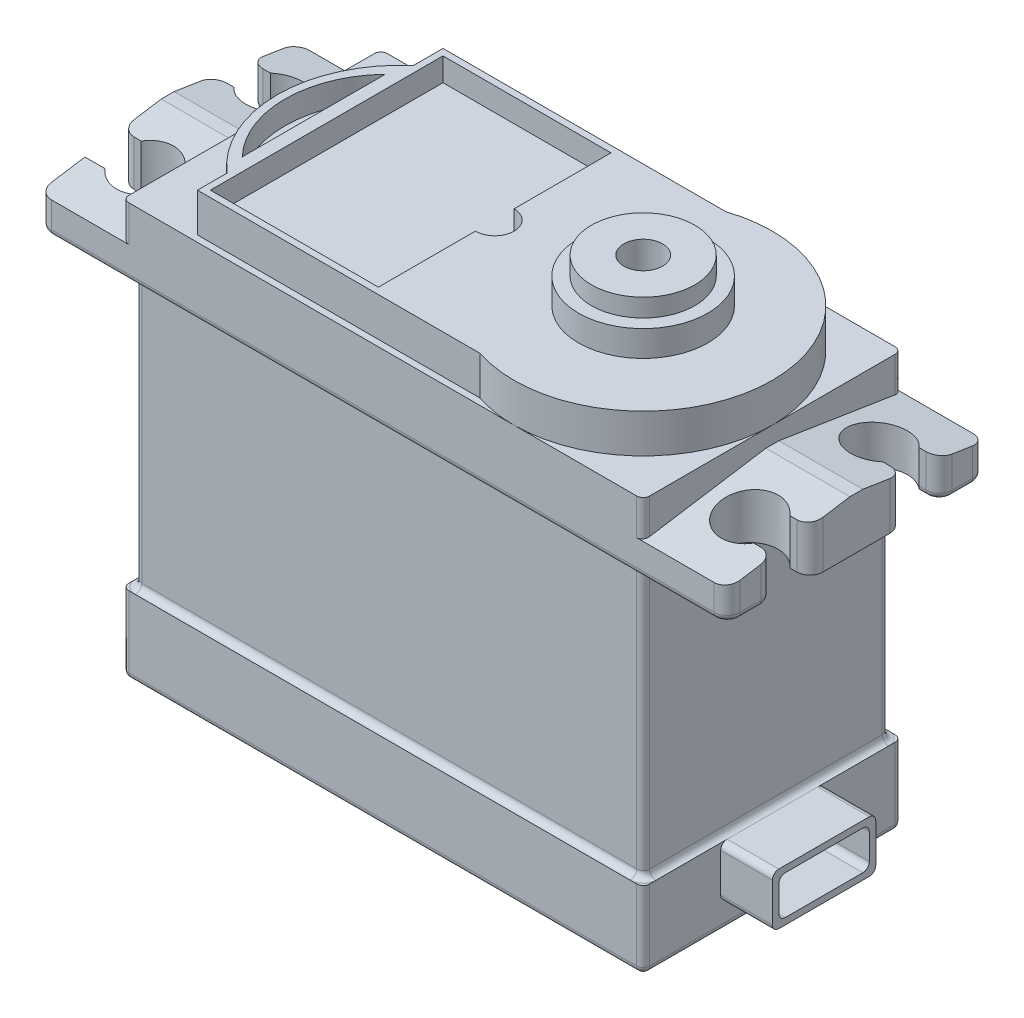
from build123d import *

# Parameters (mm, degrees)
SKETCH_2_W               = 40.3
SKETCH_2_H               = 32
EXTRUDE_1_DEPTH          = 20
SKETCH_3_W               = 20
SKETCH_3_H               = 4
EXTRUDE_2_DEPTH          = 6.5
CUT_EXTRUDE_4_DEPTH      = 6.5
SKETCH_4_W               = 20
SKETCH_4_H               = 4
EXTRUDE_3_DEPTH          = 6.5
CUT_EXTRUDE_5_DEPTH      = 6.5
CUT_EXTRUDE_6_DEPTH      = 43.284026865
CUT_EXTRUDE_6_DEPTH_BACK = 1.5
SKETCH_7_W               = 8
SKETCH_7_H               = 4
SKETCH_7_W_2             = 7
SKETCH_7_H_2             = 3
EXTRUDE_4_DEPTH          = 4
EXTRUDE_5_DEPTH          = 3
SKETCH_9_R               = 5
EXTRUDE_6_DEPTH          = 2
SKETCH_10_R              = 4
EXTRUDE_7_DEPTH          = 1.4
SKETCH_11_R              = 1.5
CUT_EXTRUDE_3_DEPTH      = 6.4
SKETCH_17_W              = 20
SKETCH_17_H              = 20.7
CUT_EXTRUDE_7_DEPTH      = 0.5
SKETCH_18_W              = 39.8
SKETCH_18_H              = 20.7
CUT_EXTRUDE_8_DEPTH      = 0.5
SKETCH_19_W              = 19.5
SKETCH_19_H              = 20.7
CUT_EXTRUDE_9_DEPTH      = 0.5
SKETCH_20_W              = 39.3
SKETCH_20_H              = 20.7
CUT_EXTRUDE_10_DEPTH     = 0.5
FILLET_5_R               = 1
FILLET_6_R               = 0.5
FILLET_7_R               = 0.5
FILLET_8_R               = 0.5
FILLET_9_R               = 0.5
CUT_EXTRUDE_12_DEPTH     = 1.8


with BuildPart() as part:
    # 草圖2 → 填料-伸長1 (new body)
    with BuildSketch(Plane.XY):
        with Locations((2.485695538, -7.217454068)):
            Rectangle(SKETCH_2_W, SKETCH_2_H)
    extrude(amount=EXTRUDE_1_DEPTH)

    # 草圖3 → 填料-伸長2 (add)
    with BuildSketch(Plane(origin=(22.635695538, 0, 0), x_dir=(0, 0, -1), z_dir=(1, 0, 0))):
        with Locations((-10, 5.482545932)):
            Rectangle(SKETCH_3_W, SKETCH_3_H)
    extrude(amount=EXTRUDE_2_DEPTH)

    # 草圖13 → 除料-伸長4 (cut)
    with BuildSketch(Plane(origin=(29.135695538, 0, 0), x_dir=(0, 0, -1), z_dir=(1, 0, 0))):
        Polygon((-20, 5.982545932), (-10.5, 7.482545932), (-20, 7.482545932), align=None)
        Polygon((0, 7.482545932), (-9.5, 7.482545932), (0, 5.982545932), align=None)
    extrude(amount=-CUT_EXTRUDE_4_DEPTH, mode=Mode.SUBTRACT)

    # 草圖4 → 填料-伸長3 (add)
    with BuildSketch(Plane.ZY.offset(17.664304462)):
        with Locations((10, 5.482545932)):
            Rectangle(SKETCH_4_W, SKETCH_4_H)
    extrude(amount=EXTRUDE_3_DEPTH)

    # 草圖14 → 除料-伸長5 (cut)
    with BuildSketch(Plane.ZY.offset(24.164304462)):
        Polygon((0, 5.982545932), (9.5, 7.482545932), (0, 7.482545932), align=None)
        Polygon((20, 7.482545932), (10.5, 7.482545932), (20, 5.982545932), align=None)
    extrude(amount=-CUT_EXTRUDE_5_DEPTH, mode=Mode.SUBTRACT)

    # 草圖16 → 除料-伸長6 (cut, two sides: drawn at the far end of the back side and taken through both)
    with BuildSketch(Plane(origin=(0, 0, 0), x_dir=(1, 0, 0), z_dir=(0, 1, 0)).offset(-CUT_EXTRUDE_6_DEPTH_BACK)):
        with BuildLine():
            Line((-24.164304462, -3.6), (-24.164304462, -6.4))
            Line((-24.164304462, -6.4), (-22.611360737, -6.4))
            ThreePointArc((-22.611360737, -6.4), (-18.714304462, -5), (-22.611360737, -3.6))
            Line((-22.611360737, -3.6), (-24.164304462, -3.6))
        make_face()
        with BuildLine():
            Line((-24.164304462, -13.6), (-24.164304462, -16.4))
            Line((-24.164304462, -16.4), (-22.611360737, -16.4))
            ThreePointArc((-22.611360737, -16.4), (-18.714304462, -15), (-22.611360737, -13.6))
            Line((-22.611360737, -13.6), (-24.164304462, -13.6))
        make_face()
        with BuildLine():
            Line((27.582751813, -16.4), (29.135695538, -16.4))
            Line((29.135695538, -16.4), (29.135695538, -13.6))
            Line((29.135695538, -13.6), (27.582751813, -13.6))
            ThreePointArc((27.582751813, -13.6), (23.685695538, -15), (27.582751813, -16.4))
        make_face()
        with BuildLine():
            Line((27.582751813, -6.4), (29.135695538, -6.4))
            Line((29.135695538, -6.4), (29.135695538, -3.6))
            Line((29.135695538, -3.6), (27.582751813, -3.6))
            ThreePointArc((27.582751813, -3.6), (23.685695538, -5), (27.582751813, -6.4))
        make_face()
    extrude(amount=CUT_EXTRUDE_6_DEPTH + CUT_EXTRUDE_6_DEPTH_BACK, mode=Mode.SUBTRACT)

    # 草圖7 → 填料-伸長4 (add)
    with BuildSketch(Plane(origin=(22.635695538, 0, 0), x_dir=(0, 0, -1), z_dir=(1, 0, 0))):
        with Locations((-10, -19.217454068)):
            Rectangle(SKETCH_7_W, SKETCH_7_H)
        with Locations((-10, -19.217454068)):
            Rectangle(SKETCH_7_W_2, SKETCH_7_H_2, mode=Mode.SUBTRACT)
    extrude(amount=EXTRUDE_4_DEPTH)

    # 草圖8 → 填料-伸長5 (add)
    with BuildSketch(Plane(origin=(0, 8.782545932, 0), x_dir=(1, 0, 0), z_dir=(0, 1, 0))):
        with BuildLine():
            Line((-12.354443672, -17.206398307), (-12.354443672, -19.5))
            Line((-12.354443672, -19.5), (9.513196539, -19.5))
            ThreePointArc((9.513196539, -19.5), (22.635695538, -10), (9.513196539, -0.5))
            Line((9.513196539, -0.5), (-12.354443672, -0.5))
            Line((-12.354443672, -0.5), (-12.354443672, -2.793601693))
            ThreePointArc((-12.354443672, -2.793601693), (-15.664304462, -10), (-12.354443672, -17.206398307))
        make_face()
    extrude(amount=EXTRUDE_5_DEPTH)

    # 草圖9 → 填料-伸長6 (add)
    with BuildSketch(Plane(origin=(0, 11.782545932, 0), x_dir=(1, 0, 0), z_dir=(0, 1, 0))):
        with Locations(Location((12.635695538, -10, 0), (0, 0, 270))):
            Circle(SKETCH_9_R)
    extrude(amount=EXTRUDE_6_DEPTH)

    # 草圖10 → 填料-伸長7 (add)
    with BuildSketch(Plane(origin=(0, 13.782545932, 0), x_dir=(1, 0, 0), z_dir=(0, 1, 0))):
        with Locations(Location((12.635695538, -10, 0), (0, 0, 270))):
            Circle(SKETCH_10_R)
    extrude(amount=EXTRUDE_7_DEPTH)

    # 草圖11 → 除料-伸長3 (cut)
    with BuildSketch(Plane(origin=(0, 15.182545932, 0), x_dir=(1, 0, 0), z_dir=(0, 1, 0))):
        with Locations(Location((12.635695538, -10, 0), (0, 0, 270))):
            Circle(SKETCH_11_R)
    extrude(amount=-CUT_EXTRUDE_3_DEPTH, mode=Mode.SUBTRACT)

    # 草圖17 → 除料-伸長7 (cut)
    with BuildSketch(Plane(origin=(22.635695538, 0, 0), x_dir=(0, 0, -1), z_dir=(1, 0, 0))):
        with Locations((-10, -6.867454068)):
            Rectangle(SKETCH_17_W, SKETCH_17_H)
    extrude(amount=-CUT_EXTRUDE_7_DEPTH, mode=Mode.SUBTRACT)

    # 草圖18 → 除料-伸長8 (cut)
    with BuildSketch(Plane.XY.offset(20)):
        with Locations((2.235695538, -6.867454068)):
            Rectangle(SKETCH_18_W, SKETCH_18_H)
    extrude(amount=-CUT_EXTRUDE_8_DEPTH, mode=Mode.SUBTRACT)

    # 草圖19 → 除料-伸長9 (cut)
    with BuildSketch(Plane.ZY.offset(17.664304462)):
        with Locations((9.75, -6.867454068)):
            Rectangle(SKETCH_19_W, SKETCH_19_H)
    extrude(amount=-CUT_EXTRUDE_9_DEPTH, mode=Mode.SUBTRACT)

    # 草圖20 → 除料-伸長10 (cut)
    with BuildSketch(Plane(origin=(0, 0, 0), x_dir=(-1, 0, 0), z_dir=(0, 0, -1))):
        with Locations((-2.485695538, -6.867454068)):
            Rectangle(SKETCH_20_W, SKETCH_20_H)
    extrude(amount=-CUT_EXTRUDE_10_DEPTH, mode=Mode.SUBTRACT)

    # 圓角5
    fillet_5_edges = [part.edges().sort_by_distance(p)[0] for p in [
        (29.135695538, 5.23780909, 13.6),
        (29.135695538, 5.016756458, 16.4),
        (-24.164304462, 5.23780909, 13.6),
        (29.135695538, 5.016756458, 3.6),
        (29.135695538, 5.23780909, 6.4),
        (-24.164304462, 5.23780909, 6.4),
        (-24.164304462, 5.016756458, 3.6),
        (29.135695538, 4.732545932, 0),
        (29.135695538, 4.732545932, 20),
        (-24.164304462, 4.732545932, 20),
        (-24.164304462, 4.732545932, 0),
    ]]
    fillet(fillet_5_edges, radius=FILLET_5_R)

    # 圓角6
    fillet_6_edges = [part.edges().sort_by_distance(p)[0] for p in [
        (-17.664304462, 7.382545932, 20),
        (22.635695538, -20.217454068, 0),
        (22.635695538, -20.217454068, 20),
        (-17.664304462, -20.217454068, 20),
        (22.135695538, -6.867454068, 19.5),
        (-17.664304462, -20.217454068, 0),
        (-17.164304462, -6.867454068, 19.5),
        (22.135695538, -6.867454068, 0.5),
        (-17.164304462, -6.867454068, 0.5),
        (-17.664304462, 7.382545932, 0),
        (22.635695538, 7.382545932, 0),
        (22.635695538, 7.382545932, 20),
    ]]
    fillet(fillet_6_edges, radius=FILLET_6_R)

    # 圓角7
    fillet_7_edges = [part.edges().sort_by_distance(p)[0] for p in [
        (2.485695538, -23.217454068, 0),
        (22.635695538, -23.217454068, 10),
        (2.485695538, -23.217454068, 20),
        (-17.664304462, -23.217454068, 10),
        (-17.517857853, -23.217454068, 0.146446609),
        (-17.517857853, -23.217454068, 19.853553391),
        (22.489248929, -23.217454068, 19.853553391),
        (22.489248929, -23.217454068, 0.146446609),
        (2.485695538, -17.217454068, 0.5),
        (22.135695538, -17.217454068, 10),
        (2.485695538, -17.217454068, 19.5),
        (-17.164304462, -17.217454068, 10),
        (-17.017857853, -17.217454068, 0.646446609),
        (-17.017857853, -17.217454068, 19.353553391),
        (21.989248929, -17.217454068, 19.353553391),
        (21.989248929, -17.217454068, 0.646446609),
    ]]
    fillet(fillet_7_edges, radius=FILLET_7_R - 0.0001)  # a hair under: the kernel refuses the full size

    # 圓角8
    fillet_8_edges = [part.edges().sort_by_distance(p)[0] for p in [
        (27.859223675, 3.482545932, 3.6),
        (28.842802319, 3.482545932, 3.307106781),
        (29.135695538, 3.482545932, 1.8),
        (28.842802319, 3.482545932, 0.292893219),
        (-22.887832599, 3.482545932, 3.6),
        (-23.871411243, 3.482545932, 3.307106781),
        (-24.164304462, 3.482545932, 1.8),
        (-23.871411243, 3.482545932, 0.292893219),
        (27.859223675, 3.482545932, 16.4),
        (28.842802319, 3.482545932, 16.692893219),
        (29.135695538, 3.482545932, 18.2),
        (28.842802319, 3.482545932, 19.707106781),
        (-24.164304462, 3.482545932, 17.7),
        (-23.871411243, 3.482545932, 19.707106781),
        (2.485695538, 3.482545932, 0),
        (2.485695538, 3.482545932, 20),
    ]]
    fillet(fillet_8_edges, radius=FILLET_8_R - 0.0001)  # a hair under: the kernel refuses the full size

    # 圓角9
    fillet_9_edges = [part.edges().sort_by_distance(p)[0] for p in [
        (24.635695538, -21.217454068, 6),
        (24.635695538, -17.217454068, 6),
        (24.635695538, -17.217454068, 14),
        (24.635695538, -21.217454068, 14),
        (24.635695538, -17.717454068, 6.5),
        (24.635695538, -17.717454068, 13.5),
        (24.635695538, -20.717454068, 13.5),
        (24.635695538, -20.717454068, 6.5),
    ]]
    fillet(fillet_9_edges, radius=FILLET_9_R)

    # 草圖22 → 除料-伸長12 (cut)
    with BuildSketch(Plane(origin=(0, 11.782545932, 0), x_dir=(1, 0, 0), z_dir=(0, 1, 0))):
        with BuildLine():
            Line((1.145556328, -1), (-11.854443672, -1))
            Line((-11.854443672, -1), (-11.854443672, -19))
            Line((-11.854443672, -19), (1.145556328, -19))
            Line((1.145556328, -19), (1.145556328, -11.5))
            ThreePointArc((1.145556328, -11.5), (2.645556328, -10), (1.145556328, -8.5))
            Line((1.145556328, -8.5), (1.145556328, -1))
        make_face()
        with BuildLine():
            Line((-12.854443672, -4.463311785), (-12.854443672, -15.536688215))
            ThreePointArc((-12.854443672, -15.536688215), (-15.079923466, -10), (-12.854443672, -4.463311785))
        make_face()
    extrude(amount=-CUT_EXTRUDE_12_DEPTH, mode=Mode.SUBTRACT)


solid = part.part
